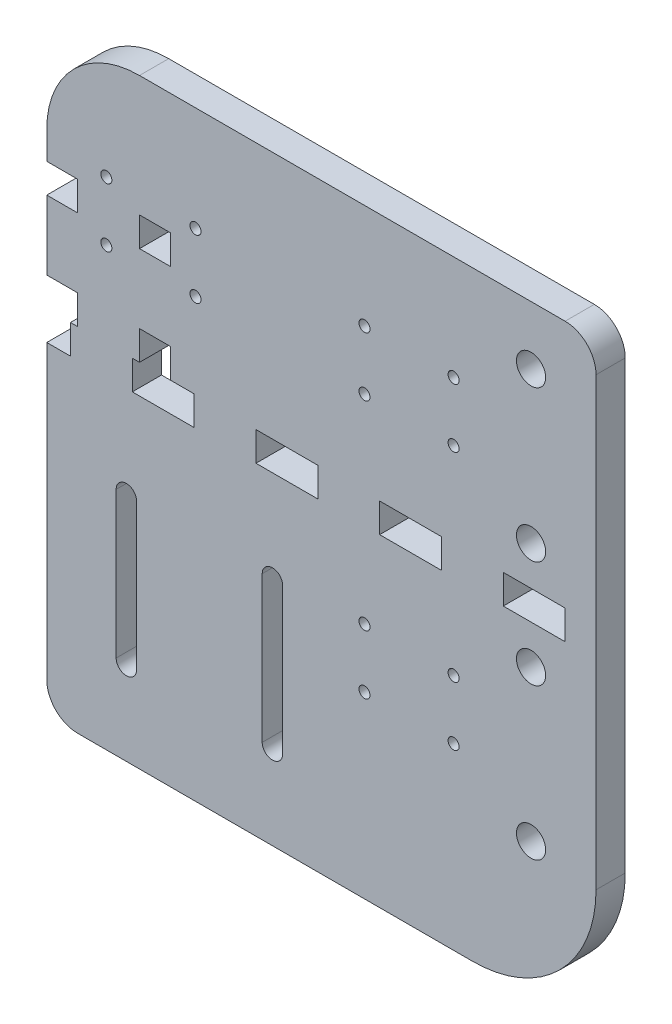
from build123d import *

# Parameters (mm, degrees)
SKETCH1_R           = 3
SKETCH1_R_2         = 1.13211215
SKETCH1_W           = 12.7
SKETCH1_H           = 5.9944
SKETCH1_W_2         = 6.35
SKETCH1_H_2         = 6
BOSS_EXTRUDE1_DEPTH = 5.9944


with BuildPart() as part:
    # Sketch1 → Boss-Extrude1 (new body)
    with BuildSketch(Plane(origin=(0, 0, 0), x_dir=(-1, 0, 0), z_dir=(0, 0, 1))):
        with BuildLine():
            Line((70.702589937, -10.904229729), (70.702589937, -10.32825998))
            Line((70.702589936, -10.32825998), (64.352589936, -10.32825998))
            Line((64.352589936, -10.32825998), (64.352589936, -4.32825998))
            Line((64.352589936, -4.32825998), (65.829579937, -4.32825998))
            Line((65.829579937, -4.32825998), (65.829579937, 1.66614002))
            Line((65.829579937, 1.66614002), (70.702589937, 1.66614002))
            Line((70.702589937, 1.66614002), (70.702589937, 61.66894002))
            ThreePointArc((70.702589937, 61.66894002), (68.842717997, 66.15906808), (64.352589937, 68.01894002))
            Line((64.352589937, 68.01894002), (-16.720420067, 68.01894002))
            ThreePointArc((-16.720420067, 68.01894002), (-34.680932309, 60.579452262), (-42.120420067, 42.61894002))
            Line((-42.120420067, 42.61894002), (-42.120420067, -49.004229729))
            ThreePointArc((-42.120420067, -49.004229729), (-40.260548127, -53.494357789), (-35.770420067, -55.354229729))
            Line((-35.770420067, -55.354229729), (26.252589933, -55.354229729))
            Line((26.252589933, -55.354229729), (45.302589936, -55.354229729))
            Line((45.302589936, -55.354229729), (51.652589937, -55.354229729))
            ThreePointArc((51.652589937, -55.354229729), (65.122974118, -49.77461391), (70.702589937, -36.304229729))
            Line((70.702589937, -36.304229729), (70.702589937, -30.55225998))
            Line((70.702589937, -30.55225998), (64.352589937, -30.55225998))
            Line((64.352589937, -30.55225998), (64.352589937, -24.55225998))
            Line((64.352589937, -24.55225998), (70.702589937, -24.55225998))
            Line((70.702589937, -24.55225998), (70.702589937, -10.904229729))
        make_face()
        with Locations((-28.770420063, -43.34064498)):
            Circle(SKETCH1_R, mode=Mode.SUBTRACT)
        with Locations((-12.862735063, -33.89562768)):
            Circle(SKETCH1_R_2, mode=Mode.SUBTRACT)
        with Locations((5.444904937, -33.89562768)):
            Circle(SKETCH1_R_2, mode=Mode.SUBTRACT)
        with Locations((-28.770420063, -12.34064498)):
            Circle(SKETCH1_R, mode=Mode.SUBTRACT)
        with Locations((-29.420420063, -1.33105998)):
            Rectangle(SKETCH1_W, SKETCH1_H, mode=Mode.SUBTRACT)
        with Locations((-12.862735063, -21.78027768)):
            Circle(SKETCH1_R_2, mode=Mode.SUBTRACT)
        with Locations((5.444904937, -21.78027768)):
            Circle(SKETCH1_R_2, mode=Mode.SUBTRACT)
        with Locations((-4.020420063, -1.33105998)):
            Rectangle(SKETCH1_W, SKETCH1_H, mode=Mode.SUBTRACT)
        with Locations((40.156434997, -33.89562768)):
            Circle(SKETCH1_R_2, mode=Mode.SUBTRACT)
        with Locations((48.477589937, -27.55225998)):
            Rectangle(SKETCH1_W_2, SKETCH1_H_2, mode=Mode.SUBTRACT)
        with Locations((58.464074997, -33.89562768)):
            Circle(SKETCH1_R_2, mode=Mode.SUBTRACT)
        with Locations((40.156434997, -21.78027768)):
            Circle(SKETCH1_R_2, mode=Mode.SUBTRACT)
        with Locations((21.379579937, -1.33105998)):
            Rectangle(SKETCH1_W, SKETCH1_H, mode=Mode.SUBTRACT)
        with Locations((58.464074997, -21.78027768)):
            Circle(SKETCH1_R_2, mode=Mode.SUBTRACT)
        Polygon((45.302589936, -4.32825998), (40.429579937, -4.32825998), (40.429579937, 1.66614002), (53.129579937, 1.66614002), (53.129579937, -4.32825998), (51.652589936, -4.32825998), (51.652589936, -10.32825998), (45.302589936, -10.32825998), align=None, mode=Mode.SUBTRACT)
        with Locations((-28.770420063, 9.67852502)):
            Circle(SKETCH1_R, mode=Mode.SUBTRACT)
        with Locations((-12.862735063, 19.11815772)):
            Circle(SKETCH1_R_2, mode=Mode.SUBTRACT)
        with Locations((5.444904937, 19.11815772)):
            Circle(SKETCH1_R_2, mode=Mode.SUBTRACT)
        with Locations((-12.862735063, 31.23350772)):
            Circle(SKETCH1_R_2, mode=Mode.SUBTRACT)
        with Locations((5.444904937, 31.23350772)):
            Circle(SKETCH1_R_2, mode=Mode.SUBTRACT)
        with Locations((-28.770420063, 40.67852502)):
            Circle(SKETCH1_R, mode=Mode.SUBTRACT)
        with BuildLine():
            ThreePointArc((26.452589937, 20.66894002), (24.352589937, 18.56894002), (22.252589937, 20.66894002))
            Line((22.252589937, 20.66894002), (22.252589937, 50.66894002))
            ThreePointArc((22.252589937, 50.66894002), (24.352589937, 52.76894002), (26.452589937, 50.66894002))
            Line((26.452589937, 50.66894002), (26.452589937, 20.66894002))
        make_face(mode=Mode.SUBTRACT)
        with BuildLine():
            Line((56.452589937, 50.66894002), (56.452589937, 20.66894002))
            ThreePointArc((56.452589937, 20.66894002), (54.352589937, 18.56894002), (52.252589937, 20.66894002))
            Line((52.252589937, 20.66894002), (52.252589937, 50.66894002))
            ThreePointArc((52.252589937, 50.66894002), (54.352589937, 52.76894002), (56.452589937, 50.66894002))
        make_face(mode=Mode.SUBTRACT)
    extrude(amount=BOSS_EXTRUDE1_DEPTH)


solid = part.part
